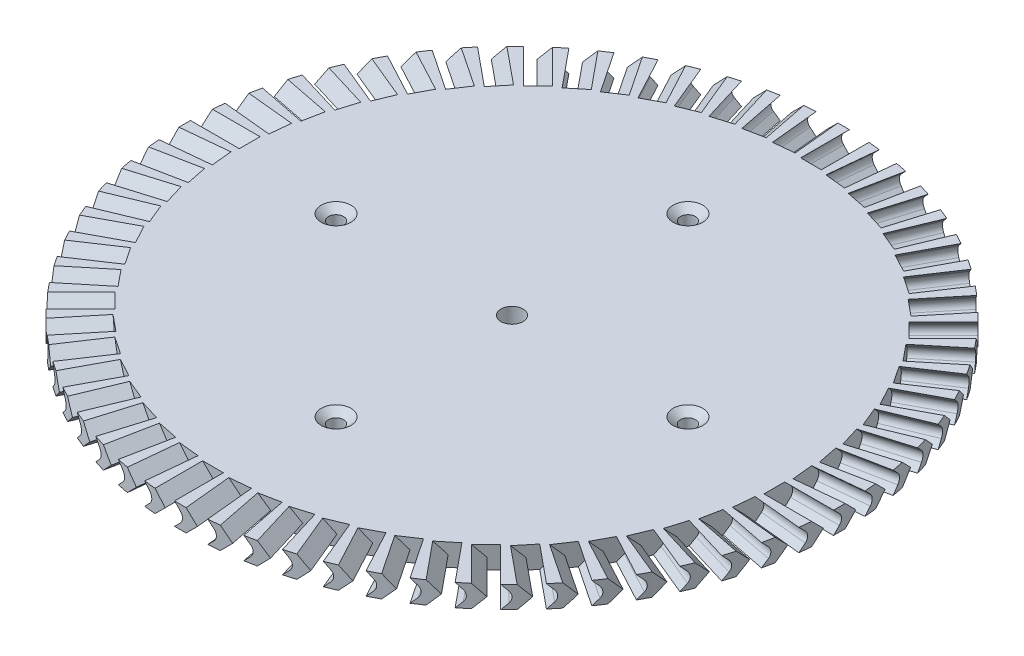
from build123d import *

# Parameters (mm, degrees)
SKETCH1_R           = 142.70355
SKETCH1_R_2         = 4.7625
BOSS_EXTRUDE1_DEPTH = 9.525
CUT_EXTRUDE1_DEPTH  = 21.1582
CIRPATTERN1_COUNT   = 64
CIRPATTERN2_COUNT   = 4


with BuildPart() as part:
    # Sketch1 → Boss-Extrude1 (new body)
    with BuildSketch(Plane(origin=(0, 0, 0), x_dir=(1, 0, 0), z_dir=(0, 1, 0))):
        Circle(SKETCH1_R)
        Circle(SKETCH1_R_2, mode=Mode.SUBTRACT)
    extrude(amount=BOSS_EXTRUDE1_DEPTH)

    # Sketch2 → Cut-Extrude1 (cut)
    with BuildSketch(Plane.XY.offset(142.70355)):
        with BuildLine():
            Line((-3.447371939, 0), (-0.92993597, 2.51743597))
            ThreePointArc((-0.92993597, 2.51743597), (0, 4.7625), (-0.92993597, 7.00756403))
            Line((-0.92993597, 7.00756403), (-3.447371939, 9.525))
            Line((-3.447371939, 9.525), (-12.427628061, 9.525))
            Line((-12.427628061, 9.525), (-7.665128061, 4.7625))
            Line((-7.665128061, 4.7625), (-12.427628061, 0))
            Line((-12.427628061, 0), (-3.447371939, 0))
        make_face()
    cut_extrude1 = extrude(amount=-CUT_EXTRUDE1_DEPTH, mode=Mode.SUBTRACT)

    # CirPattern1: Cut-Extrude1 ×64 about axis
    cirpattern1_axis = Axis((0, 9.525, 0), (0, -1, 0))
    for i in range(1, CIRPATTERN1_COUNT):
        add(cut_extrude1.rotate(cirpattern1_axis, i * 360 / CIRPATTERN1_COUNT), mode=Mode.SUBTRACT)

    # Sketch3 → CSK for 1/4 Flat Head Machine Screw (100)1 (revolve, cut)
    with BuildSketch(Plane(origin=(0, 9.525, 76.2), x_dir=(0, 0, 1), z_dir=(1, 0, 0))):
        Polygon((0, 0), (0, 14.661148974), (3.2639, 12.7), (3.2639, 2.664141329), (6.4389, 0), align=None)
    csk_for_1_4_flat_head_machine_screw_100 = revolve(axis=Axis((0, 15.875, 76.2), (0, -1, 0)), mode=Mode.SUBTRACT)

    # CirPattern2: CSK for 1/4 Flat Head Machine Screw (100)1 ×4 about axis
    cirpattern2_axis = Axis((0, 9.525, 0), (0, -1, 0))
    for i in range(1, CIRPATTERN2_COUNT):
        add(csk_for_1_4_flat_head_machine_screw_100.rotate(cirpattern2_axis, i * 360 / CIRPATTERN2_COUNT), mode=Mode.SUBTRACT)


solid = part.part
